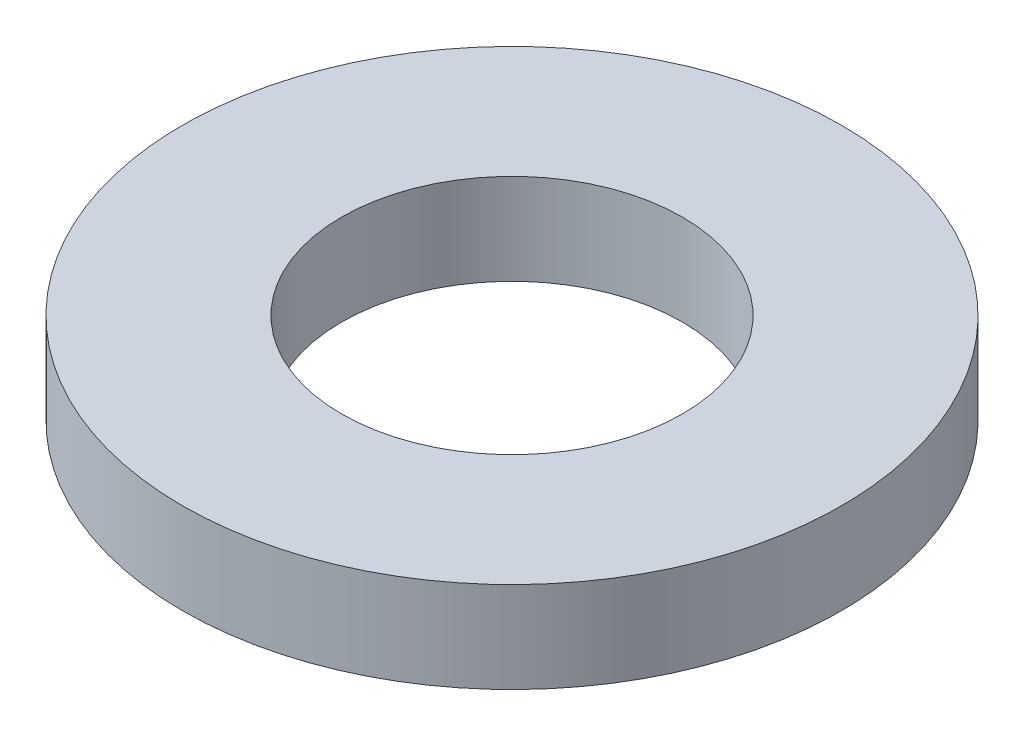
from build123d import *

# Parameters (mm, degrees)
SKETCH1_R           = 72.5
BOSS_EXTRUDE1_DEPTH = 20
SKETCH2_R           = 37.5
CUT_EXTRUDE1_DEPTH  = 105.462912079


with BuildPart() as part:
    # Sketch1 → Boss-Extrude1 (new body)
    with BuildSketch(Plane(origin=(0, 0, 0), x_dir=(1, 0, 0), z_dir=(0, 1, 0))):
        Circle(SKETCH1_R)
    extrude(amount=BOSS_EXTRUDE1_DEPTH)

    # Sketch2 → Cut-Extrude1 (cut, through all)
    with BuildSketch(Plane(origin=(0, 0, 0), x_dir=(1, 0, 0), z_dir=(0, 1, 0))):
        Circle(SKETCH2_R)
    extrude(amount=CUT_EXTRUDE1_DEPTH, mode=Mode.SUBTRACT)


solid = part.part
